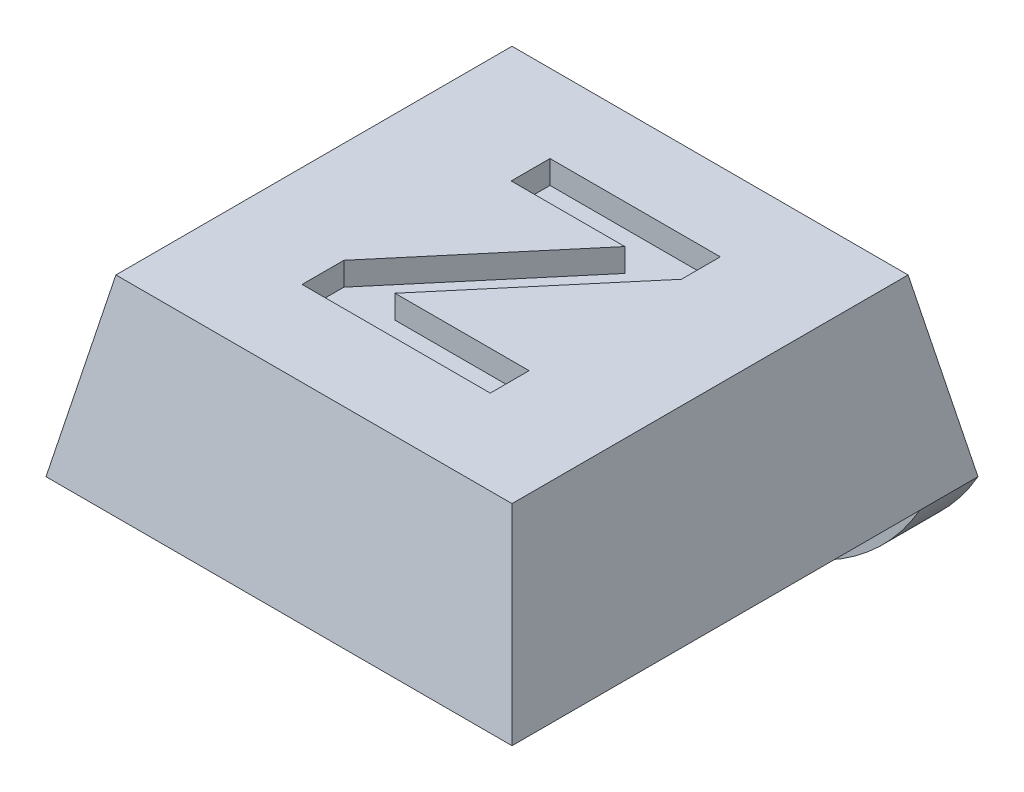
from build123d import *

# Parameters (mm, degrees)
SKETCH1_W               = 8
SKETCH1_H               = 8
BOSS_EXTRUDE1_DEPTH     = 3
CUT_EXTRUDE1_DEPTH      = 12.704699911
CUT_EXTRUDE1_DEPTH_BACK = 12.704699911
CUT_EXTRUDE2_DEPTH      = 11
SKETCH4_R               = 1.75
CUT_EXTRUDE3_DEPTH      = 0.4
SKETCH5_W               = 8
SKETCH5_H               = 1
BOSS_EXTRUDE2_DEPTH     = 2
FILLET1_R               = 4
CUT_EXTRUDE4_DEPTH      = 0.4


with BuildPart() as part:
    # Sketch1 → Boss-Extrude1 (new body)
    with BuildSketch(Plane(origin=(0, 0, 0), x_dir=(1, 0, 0), z_dir=(0, 1, 0))):
        with Locations((4, 4)):
            Rectangle(SKETCH1_W, SKETCH1_H)
    extrude(amount=BOSS_EXTRUDE1_DEPTH)

    # Sketch2 → Cut-Extrude1 (cut, two sides: drawn at the far end of the back side and taken through both)
    with BuildSketch(Plane.XY.offset(-CUT_EXTRUDE1_DEPTH_BACK)):
        Polygon((0, 0), (0.6, 3), (0, 3), align=None)
        Polygon((8, 0), (7.4, 3), (8, 3), align=None)
    extrude(amount=CUT_EXTRUDE1_DEPTH + CUT_EXTRUDE1_DEPTH_BACK, mode=Mode.SUBTRACT)

    # Sketch3 → Cut-Extrude2 (cut)
    with BuildSketch(Plane(origin=(0, 0, 0), x_dir=(0, 0, -1), z_dir=(1, 0, 0))):
        Polygon((0, 0), (0.6, 3), (0, 3), align=None)
        Polygon((8, 3), (7.4, 3), (8, 0), align=None)
    extrude(amount=CUT_EXTRUDE2_DEPTH, mode=Mode.SUBTRACT)

    # Sketch4 → Cut-Extrude3 (cut)
    with BuildSketch(Plane.XZ):
        with Locations(Location((4, -3.75, 0), (0, 0, 270))):
            Circle(SKETCH4_R)
    extrude(amount=-CUT_EXTRUDE3_DEPTH, mode=Mode.SUBTRACT)

    # Sketch5 → Boss-Extrude2 (add)
    with BuildSketch(Plane.XZ):
        with Locations((4, -7.5)):
            Rectangle(SKETCH5_W, SKETCH5_H)
    extrude(amount=BOSS_EXTRUDE2_DEPTH)

    # Fillet1
    # the kernel refuses this fillet: 4 mm, written as the material it takes off along each edge
    with BuildSketch(Plane(origin=(8, -2, -16.660254038), x_dir=(0, 1, 0), z_dir=(0, 0, 1)), Plane(origin=(0, -2, 1.660254038), x_dir=(0, 1, 0), z_dir=(0, 0, -1))) as fillet1_piece_1:
        with BuildLine():
            CenterArc((4, 3.464101615), FILLET1_R, 180, 60)
            Line((0, 3.464101615), (-0.08, 3.464101615))
            Line((-0.08, 3.464101615), (-0.08, 0))
            Line((-0.08, 0), (0, -0.08))
            ThreePointArc((0, -0.08), (1, -0.08), (1.96, -0.069282032))
            Line((1.96, -0.069282032), (2, 0))
        make_face()
    extrude(amount=18.320508076, mode=Mode.SUBTRACT)

    # Sketch6 → Cut-Extrude4 (cut)
    with BuildSketch(Plane(origin=(0, 3, 0), x_dir=(1, 0, 0), z_dir=(0, 1, 0))):
        Polygon((2.33946821, 2.056832464), (2.33946821, 2.774781182), (4.546198979, 5.390165797), (2.595878466, 5.390165797), (2.595878466, 6.056832464), (5.518955389, 6.056832464), (5.518955389, 5.390165797), (3.268154107, 2.72349913), (5.570237441, 2.72349913), (5.570237441, 2.056832464), align=None)
    extrude(amount=-CUT_EXTRUDE4_DEPTH, mode=Mode.SUBTRACT)


solid = part.part
